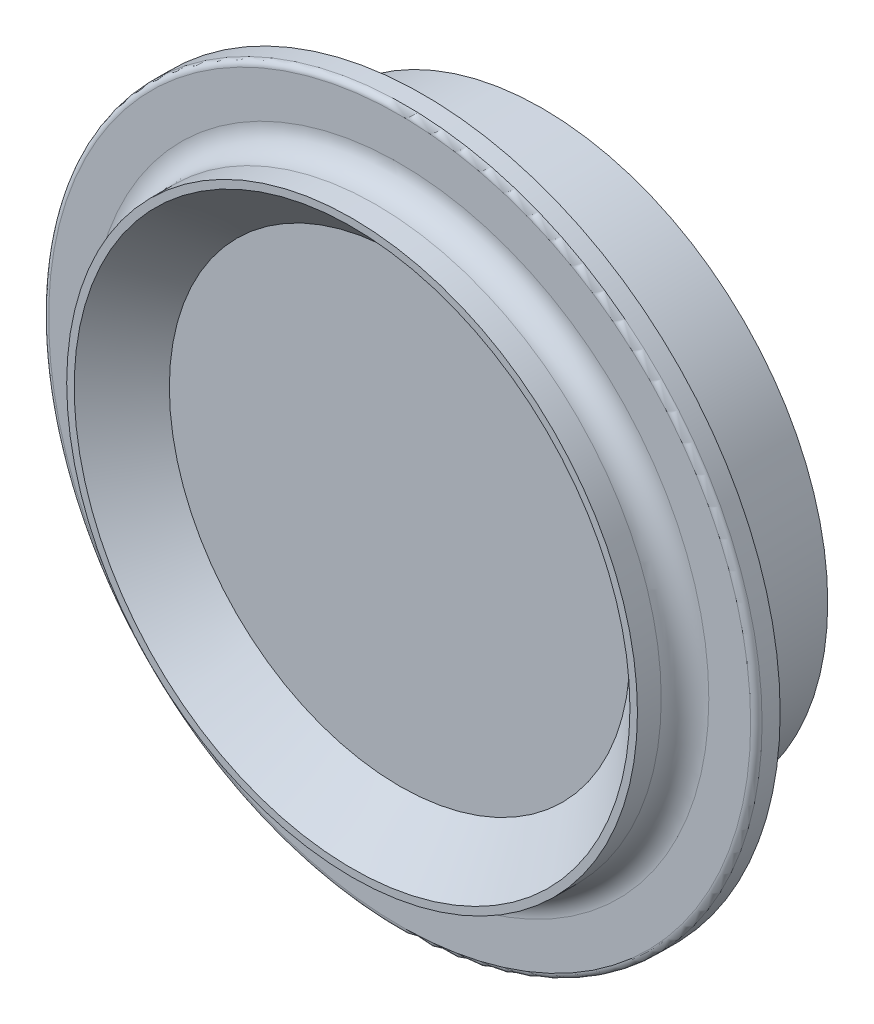
from build123d import *

# Parameters (mm, degrees)
SKETCH2_R      = 38.092749534
EXTRUDE1_DEPTH = 25.4
SKETCH3_R      = 37.09091208
EXTRUDE2_DEPTH = 6.35
CHAMFER1_SIZE  = 6.35
EXTRUDE7_START = -6.35
SKETCH10_R     = 47.61774957
SKETCH10_R_2   = 38.092749534
EXTRUDE7_DEPTH = 3.175
FILLET1_R      = 3.175
FILLET2_R      = 0.762


with BuildPart() as part:
    # Sketch2 → Extrude1 (new body)
    with BuildSketch(Plane.XY):
        with Locations((332.784130452, 254.345130463)):
            Circle(SKETCH2_R)
    extrude(amount=-EXTRUDE1_DEPTH)

    # Sketch3 → Extrude2 (cut)
    with BuildSketch(Plane.XY):
        with Locations((332.784130452, 254.345130463)):
            Circle(SKETCH3_R)
    extrude(amount=-EXTRUDE2_DEPTH, mode=Mode.SUBTRACT)

    # Chamfer1
    chamfer1_edges = [part.edges().sort_by_distance(p)[0] for p in [
        (295.693218372, 254.345130463, -6.35),
    ]]
    chamfer(chamfer1_edges, length=CHAMFER1_SIZE - 0.0001)  # a hair under: the kernel refuses the full size

    # Sketch10 → Extrude7 (add)
    with BuildSketch(Plane.XY.offset(EXTRUDE7_START)):
        with Locations((332.784130452, 254.345130463)):
            Circle(SKETCH10_R)
        with Locations((332.784130452, 254.345130463)):
            Circle(SKETCH10_R_2, mode=Mode.SUBTRACT)
    extrude(amount=-EXTRUDE7_DEPTH)

    # Fillet1
    fillet1_edges = [part.edges().sort_by_distance(p)[0] for p in [
        (294.691380918, 254.345130463, -6.35),
    ]]
    fillet(fillet1_edges, radius=FILLET1_R)

    # Fillet2
    fillet2_edges = [part.edges().sort_by_distance(p)[0] for p in [
        (285.166380882, 254.345130463, -6.35),
    ]]
    fillet(fillet2_edges, radius=FILLET2_R)


solid = part.part
